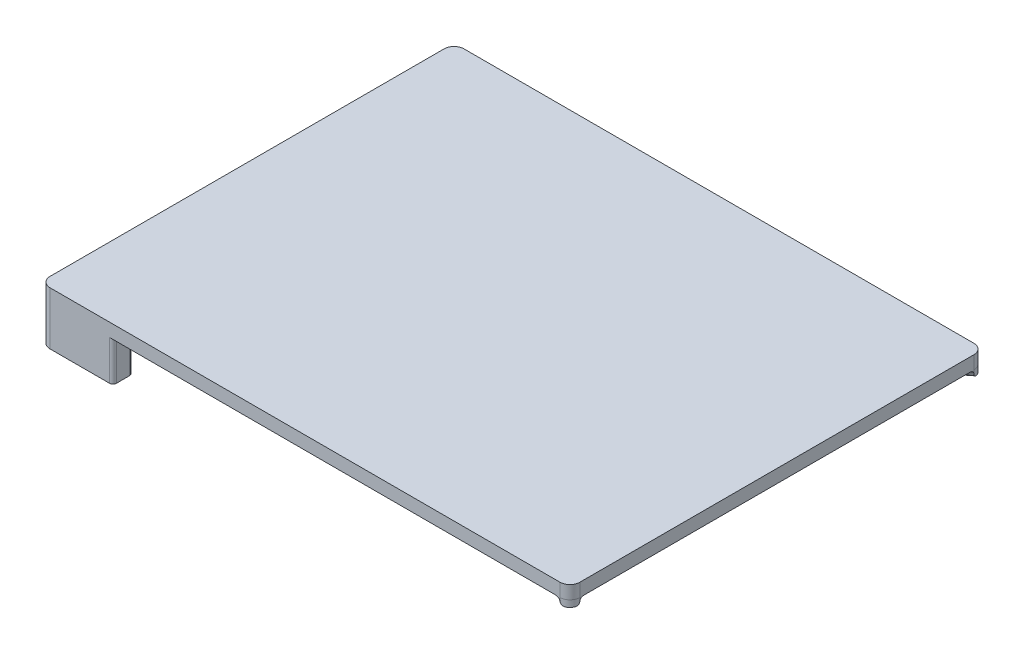
from build123d import *

# Parameters (mm, degrees)
SKETCH_1_W       = 160
SKETCH_1_H       = 125
EXTRUDE_1_DEPTH  = 4
EXTRUDE_2_DEPTH  = 12
FILLET_7_R       = 1
FILLET_8_R       = 1
FILLET_9_R       = 3
FILLET_10_R      = 1
FILLET_11_R      = 1
FILLET_12_R      = 3
FILLET_13_R      = 3
EXTRUDE_10_DEPTH = 2
FILLET_14_R      = 1
FILLET_15_R      = 1
FILLET_16_R      = 1


# Some blends are built 0.0001 mm under size
with BuildPart() as part:
    # 草图1 → 凸台-拉伸1 (new body)
    with BuildSketch(Plane(origin=(0, 0, 0), x_dir=(1, 0, 0), z_dir=(0, 1, 0))):
        with Locations((37.295606337, -35.753086772)):
            Rectangle(SKETCH_1_W, SKETCH_1_H)
    extrude(amount=EXTRUDE_1_DEPTH)

    # 草图4 → 凸台-拉伸2 (add)
    with BuildSketch(Plane.XZ):
        Polygon((-42.704393663, 98.253086772), (-20.704393663, 98.253086772), (-20.704393663, 92.253086772), (-36.704393663, 92.253086772), (-36.704393663, 76.253086772), (-42.704393663, 76.253086772), align=None)
    extrude(amount=EXTRUDE_2_DEPTH)

    # 圆角7
    fillet_7_edges = [part.edges().sort_by_distance(p)[0] for p in [
        (-36.704393663, -6, 76.253086772),
    ]]
    fillet(fillet_7_edges, radius=FILLET_7_R)

    # 圆角8
    fillet_8_edges = [part.edges().sort_by_distance(p)[0] for p in [
        (-20.704393663, -6, 92.253086772),
    ]]
    fillet(fillet_8_edges, radius=FILLET_8_R)

    # 圆角9
    fillet_9_edges = [part.edges().sort_by_distance(p)[0] for p in [
        (-36.704393663, -6, 92.253086772),
    ]]
    fillet(fillet_9_edges, radius=FILLET_9_R)

    # 圆角10
    fillet_10_edges = [part.edges().sort_by_distance(p)[0] for p in [
        (-42.704393663, -6, 76.253086772),
    ]]
    fillet(fillet_10_edges, radius=FILLET_10_R)

    # 圆角11
    fillet_11_edges = [part.edges().sort_by_distance(p)[0] for p in [
        (-20.704393663, -6, 98.253086772),
    ]]
    fillet(fillet_11_edges, radius=FILLET_11_R)

    # 圆角12
    fillet_12_edges = [part.edges().sort_by_distance(p)[0] for p in [
        (-42.704393663, -4, 98.253086772),
    ]]
    fillet(fillet_12_edges, radius=FILLET_12_R)

    # 圆角13
    fillet_13_edges = [part.edges().sort_by_distance(p)[0] for p in [
        (-42.704393663, 2, -26.746913228),
        (117.295606337, 2, -26.746913228),
        (117.295606337, 2, 98.253086772),
    ]]
    fillet(fillet_13_edges, radius=FILLET_13_R)

    # 草图5 → 凸台-拉伸10 (add)
    with BuildSketch(Plane(origin=(0, 0, 0), x_dir=(-1, 0, 0), z_dir=(0, -1, 0))):
        with BuildLine():
            Line((-36.837015956, -38.062335011), (-114.295606337, -98.253086772))
            add(Edge.make_bspline(
                [(-114.295606337, -98.253086772), (-117.038247024, -97.995727459), (-117.295606337, -95.253086772)],
                knots=[0, 0, 0, 1, 1, 1], degree=2))
            Line((-117.295606337, -95.253086772), (-40.287007767, -35.412010176))
            Line((-40.287007767, -35.412010176), (-117.295606337, 23.746913228))
            add(Edge.make_bspline(
                [(-117.295606337, 23.746913228), (-117.038247024, 26.489553916), (-114.295606337, 26.746913228)],
                knots=[0, 0, 0, 1, 1, 1], degree=2))
            Line((-114.295606337, 26.746913228), (-36.837015956, -32.757699249))
            Line((-36.837015956, -32.757699249), (39.704393663, 26.746913228))
            add(Edge.make_bspline(
                [(39.704393663, 26.746913228), (42.44703435, 26.489553916), (42.704393663, 23.746913228)],
                knots=[0, 0, 0, 1, 1, 1], degree=2))
            Line((42.704393663, 23.746913228), (-33.404221285, -35.394813037))
            Line((-33.404221285, -35.394813037), (35.27852547, -88.157717828))
            Line((35.27852547, -88.157717828), (32.715820337, -91.493652958))
            Line((32.715820337, -91.493652958), (-36.837015956, -38.062335011))
        make_face()
    extrude(amount=EXTRUDE_10_DEPTH)

    # 圆角14
    fillet_14_edges = [part.edges().sort_by_distance(p)[0] for p in [
        (-0.937152093, -2, 61.776265433),
    ]]
    fillet(fillet_14_edges, radius=FILLET_14_R)

    # 圆角15
    # the kernel refuses this fillet: 1 mm, written as the material it adds along each edge
    with BuildSketch(Plane(origin=(119.269663729, 0, 96.787067675), x_dir=(0.6135923613981474, 0, -0.7896229568812227), z_dir=(-0.7896229568812227, 0, -0.6135923613981474))) as fillet_15_piece_1_section:
        with BuildLine():
            CenterArc((FILLET_15_R, FILLET_15_R), FILLET_15_R, 180, 90)
            Line((0, FILLET_15_R), (0, 0))
            Line((0, 0), (FILLET_15_R, 0))
        make_face()
    fillet_15_piece_1 = extrude(amount=102.525784805, mode=Mode.PRIVATE)
    fillet_15_piece_1 = split(fillet_15_piece_1, bisect_by=Plane(origin=(117.295606337, -0.053080032, 94.446500889), z_dir=(-1, 0, 0)), keep=Keep.TOP, mode=Mode.PRIVATE)
    add(fillet_15_piece_1)
    with BuildSketch(Plane(origin=(38.304472039, 0, 36.935017755), x_dir=(0, -1, 0), z_dir=(0.7930142912716122, 0, -0.6092030317053444))) as fillet_15_piece_2_section:
        with BuildLine():
            CenterArc((FILLET_15_R, -FILLET_15_R), FILLET_15_R, 90, 90)
            Line((0, -FILLET_15_R), (0, 0))
            Line((0, 0), (FILLET_15_R, 0))
        make_face()
    fillet_15_piece_2 = extrude(amount=102.108714707, mode=Mode.PRIVATE)
    fillet_15_piece_2 = split(fillet_15_piece_2, bisect_by=Plane(origin=(117.295606337, -0.053270407, -22.94652956), z_dir=(-1, 0, 0)), keep=Keep.TOP, mode=Mode.PRIVATE)
    add(fillet_15_piece_2)
    with BuildSketch(Plane(origin=(-32.715820337, 0, 91.493652958), x_dir=(0, -1, 0), z_dir=(0.793014291271612, 0, -0.6092030317053444))) as fillet_15_piece_3:
        with BuildLine():
            CenterArc((FILLET_15_R, -FILLET_15_R), FILLET_15_R, 90, 90)
            Line((0, -FILLET_15_R), (0, 0))
            Line((0, 0), (FILLET_15_R, 0))
        make_face()
    extrude(amount=90.206914061)
    with BuildSketch(Plane(origin=(34.862958564, 0, 36.528354107), x_dir=(0, -1, 0), z_dir=(0.7896229568812226, 0, 0.6135923613981475))) as fillet_15_piece_4_section:
        with BuildLine():
            CenterArc((FILLET_15_R, -FILLET_15_R), FILLET_15_R, 90, 90)
            Line((0, -FILLET_15_R), (0, 0))
            Line((0, 0), (FILLET_15_R, 0))
        make_face()
    fillet_15_piece_4 = extrude(amount=103.095666679, mode=Mode.PRIVATE)
    fillet_15_piece_4 = split(fillet_15_piece_4, bisect_by=Plane(origin=(74.167395997, -0.225483059, 98.253086772), z_dir=(0, 0, -1)), keep=Keep.TOP, mode=Mode.PRIVATE)
    add(fillet_15_piece_4)
    with BuildSketch(Plane(origin=(-44.678451055, 0, -25.280894132), x_dir=(0, -1, 0), z_dir=(0.7896229568812227, 0, 0.6135923613981475))) as fillet_15_piece_5_section:
        with BuildLine():
            CenterArc((FILLET_15_R, -FILLET_15_R), FILLET_15_R, 90, 90)
            Line((0, -FILLET_15_R), (0, 0))
            Line((0, 0), (FILLET_15_R, 0))
        make_face()
    fillet_15_piece_5 = extrude(amount=101.386021056, mode=Mode.PRIVATE)
    fillet_15_piece_5 = split(fillet_15_piece_5, bisect_by=Plane(origin=(-42.704393663, -0.053084467, -22.940328321), z_dir=(1, 0, 0)), keep=Keep.TOP, mode=Mode.PRIVATE)
    add(fillet_15_piece_5)
    with BuildSketch(Plane(origin=(38.81074129, 0, 34.292107378), x_dir=(0.6137632516185373, 0, -0.7894901335435676), z_dir=(-0.7894901335435676, 0, -0.6137632516185374))) as fillet_15_piece_6_section:
        with BuildLine():
            CenterArc((FILLET_15_R, FILLET_15_R), FILLET_15_R, 180, 90)
            Line((0, FILLET_15_R), (0, 0))
            Line((0, 0), (FILLET_15_R, 0))
        make_face()
    fillet_15_piece_6 = extrude(amount=101.950432143, mode=Mode.PRIVATE)
    fillet_15_piece_6 = split(fillet_15_piece_6, bisect_by=Plane(origin=(37.982564631, -0.229326287, -26.746913228), z_dir=(0, 0, 1)), keep=Keep.TOP, mode=Mode.PRIVATE)
    add(fillet_15_piece_6)
    with BuildSketch(Plane(origin=(116.278142065, 0, -28.269920808), x_dir=(-0.6092030317053443, 0, -0.793014291271612), z_dir=(-0.7930142912716122, 0, 0.6092030317053444))) as fillet_15_piece_7_section:
        with BuildLine():
            CenterArc((FILLET_15_R, FILLET_15_R), FILLET_15_R, 180, 90)
            Line((0, FILLET_15_R), (0, 0))
            Line((0, 0), (FILLET_15_R, 0))
        make_face()
    fillet_15_piece_7 = extrude(amount=102.676159475, mode=Mode.PRIVATE)
    fillet_15_piece_7 = split(fillet_15_piece_7, bisect_by=Plane(origin=(74.176619716, -0.225468871, -26.746913228), z_dir=(0, 0, 1)), keep=Keep.TOP, mode=Mode.PRIVATE)
    add(fillet_15_piece_7)
    with BuildSketch(Plane(origin=(35.386757013, 0, 33.871805457), x_dir=(-0.6092030317053444, 0, -0.7930142912716122), z_dir=(-0.7930142912716122, 0, 0.6092030317053444))) as fillet_15_piece_8:
        with BuildLine():
            CenterArc((FILLET_15_R, FILLET_15_R), FILLET_15_R, 180, 90)
            Line((0, FILLET_15_R), (0, 0))
            Line((0, 0), (FILLET_15_R, 0))
        make_face()
    extrude(amount=89.109721301)

    # 圆角16
    fillet_16_edges = [part.edges().sort_by_distance(p)[0] for p in [
        (75.566311147, -2, 3.00539301),
        (-4.242066379, -2, 6.141009884),
        (75.566311147, -2, 68.157710891),
        (78.791307052, -2, 65.332548474),
        (78.791307052, -2, 5.832548474),
        (2.06059781, -2, 64.777993985),
    ]]
    fillet(fillet_16_edges, radius=FILLET_16_R - 0.0001)  # a hair under: the kernel refuses the full size


solid = part.part
